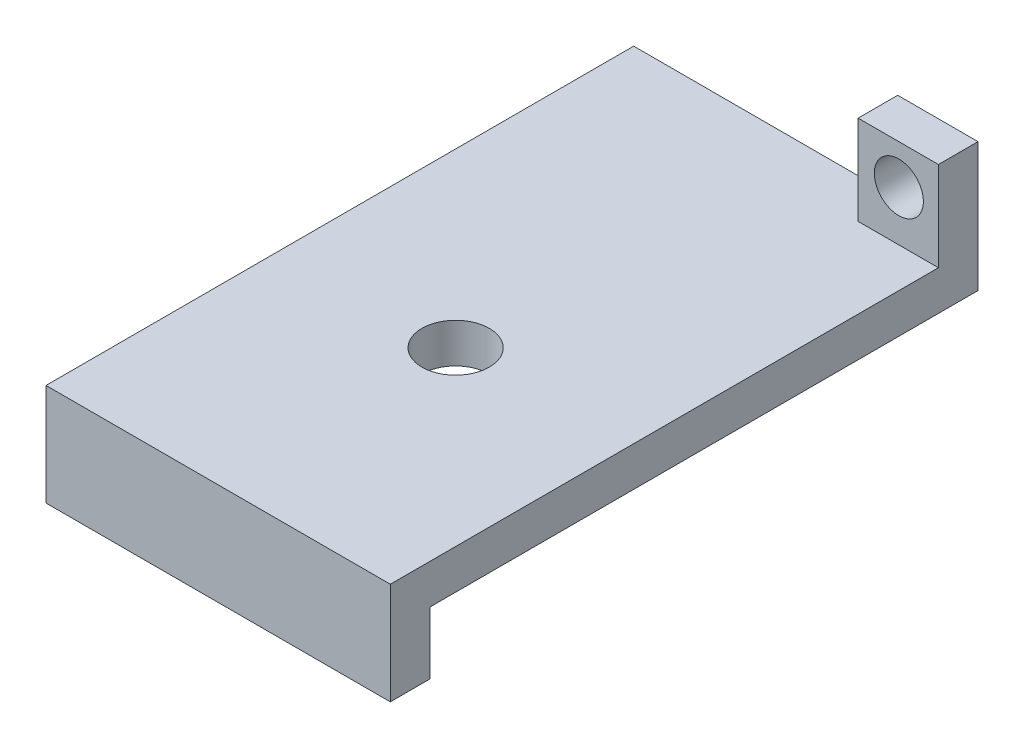
from build123d import *

# Parameters (mm, degrees)
BOSS_EXTRUDE1_DEPTH = 2.54
SKETCH7_W           = 22.098
SKETCH7_H           = 2.54
BOSS_EXTRUDE2_DEPTH = 32.639
SKETCH8_R           = 1.5748
CUT_EXTRUDE1_DEPTH  = 36.871655276
SKETCH9_R           = 2.16
CUT_EXTRUDE2_DEPTH  = 40.512563622
SKETCH10_W          = 22.098
SKETCH10_H          = 2.54
BOSS_EXTRUDE3_DEPTH = 6.54


with BuildPart() as part:
    # Sketch6 → Boss-Extrude1 (new body)
    with BuildSketch(Plane.XY):
        Polygon((11.049, 1.6891), (-6.030514123, 1.6891), (-6.030514123, -9.9695), (-11.049, -9.9695), (-11.049, 1.6891), (-11.049, 4.2291), (5.895122056, 4.2291), (5.895122056, 9.9695), (11.049, 9.9695), (11.049, 4.2291), align=None)
    extrude(amount=BOSS_EXTRUDE1_DEPTH)

    # Sketch7 → Boss-Extrude2 (add)
    with BuildSketch(Plane.XY.offset(2.54)):
        with Locations((0, 2.9591)):
            Rectangle(SKETCH7_W, SKETCH7_H)
    extrude(amount=BOSS_EXTRUDE2_DEPTH)

    # Sketch8 → Cut-Extrude1 (cut, through all)
    with BuildSketch(Plane.XY.offset(2.54)):
        with Locations((8.509, 7.4295)):
            Circle(SKETCH8_R)
        with Locations((-8.509, -5.5245)):
            Circle(SKETCH8_R)
    extrude(amount=-CUT_EXTRUDE1_DEPTH, mode=Mode.SUBTRACT)

    # Sketch9 → Cut-Extrude2 (cut, through all)
    with BuildSketch(Plane(origin=(0, 4.2291, 0), x_dir=(1, 0, 0), z_dir=(0, 1, 0))):
        with Locations((0, -22.479)):
            Circle(SKETCH9_R)
    extrude(amount=-CUT_EXTRUDE2_DEPTH, mode=Mode.SUBTRACT)

    # Sketch10 → Boss-Extrude3 (add)
    with BuildSketch(Plane(origin=(0, 4.2291, 0), x_dir=(1, 0, 0), z_dir=(0, 1, 0))):
        with Locations((0, -36.449)):
            Rectangle(SKETCH10_W, SKETCH10_H)
    extrude(amount=-BOSS_EXTRUDE3_DEPTH)


solid = part.part
